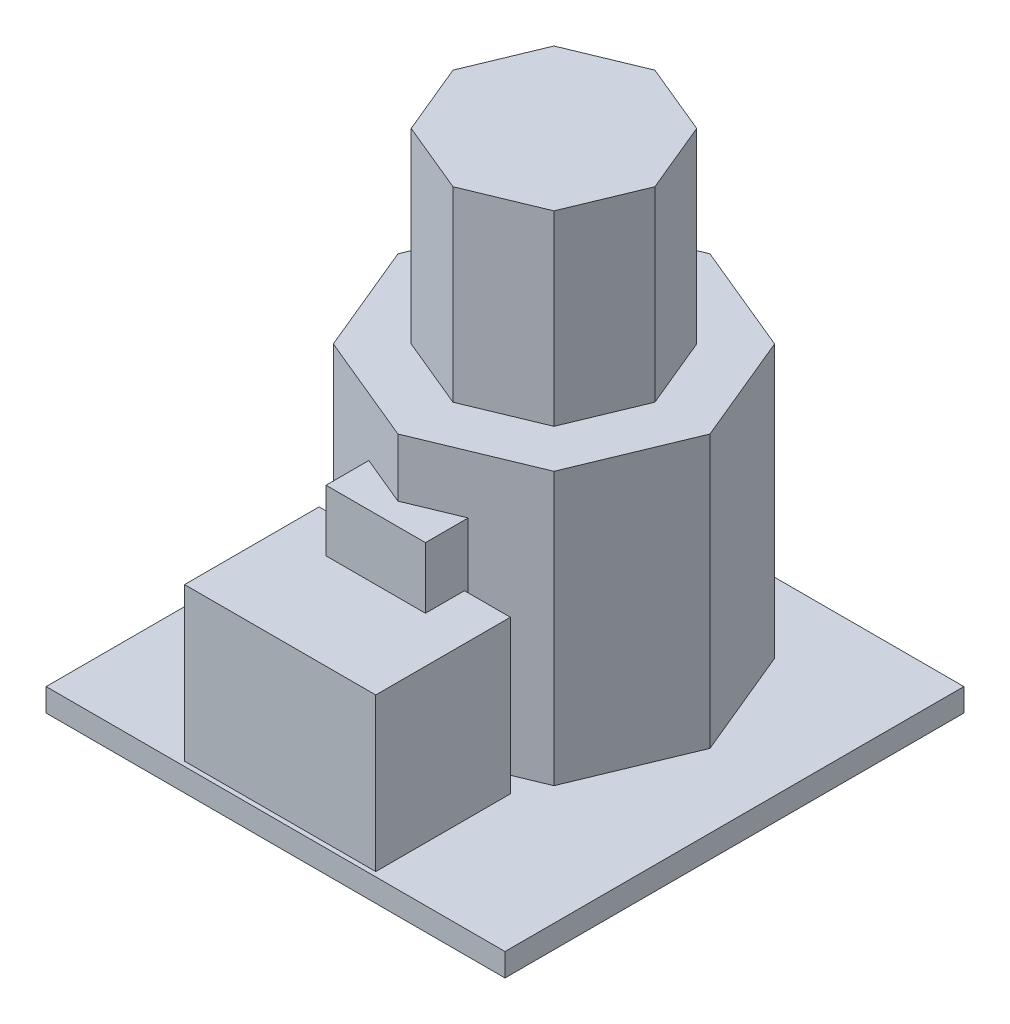
from build123d import *

# Parameters (mm, degrees)
SKETCH_1_W      = 300
SKETCH_1_H      = 300
EXTRUDE_1_DEPTH = 15
EXTRUDE_2_DEPTH = 178
EXTRUDE_3_DEPTH = 300
SKETCH_4_W      = 125
SKETCH_4_H      = 88
EXTRUDE_4_DEPTH = 100
SKETCH_5_W      = 65
SKETCH_5_H      = 45
EXTRUDE_5_DEPTH = 140


with BuildPart() as part:
    # 草图1 → 凸台-拉伸1 (new body)
    with BuildSketch(Plane(origin=(0, 0, 0), x_dir=(1, 0, 0), z_dir=(0, 1, 0))):
        Rectangle(SKETCH_1_W, SKETCH_1_H)
    extrude(amount=-EXTRUDE_1_DEPTH)

    # 草图2 → 凸台-拉伸2 (add)
    with BuildSketch(Plane(origin=(0, 0, 0), x_dir=(1, 0, 0), z_dir=(0, 1, 0))):
        Polygon((102, 32), (72.124891681, 104.124891681), (0, 134), (-72.124891681, 104.124891681), (-102, 32), (-72.124891681, -40.124891681), (0, -70), (72.124891681, -40.124891681), align=None)
    extrude(amount=EXTRUDE_2_DEPTH)

    # 草图3 → 凸台-拉伸3 (add)
    with BuildSketch(Plane(origin=(0, 0, 0), x_dir=(1, 0, 0), z_dir=(0, 1, 0))):
        Polygon((66, 32), (46.669047558, 78.669047558), (0, 98), (-46.669047558, 78.669047558), (-66, 32), (-46.669047558, -14.669047558), (0, -34), (46.669047558, -14.669047558), align=None)
    extrude(amount=EXTRUDE_3_DEPTH)

    # 草图4 → 凸台-拉伸4 (add)
    with BuildSketch(Plane(origin=(0, 0, 0), x_dir=(1, 0, 0), z_dir=(0, 1, 0))):
        with Locations((0, -103)):
            Rectangle(SKETCH_4_W, SKETCH_4_H)
    extrude(amount=EXTRUDE_4_DEPTH)

    # 草图5 → 凸台-拉伸5 (add)
    with BuildSketch(Plane(origin=(0, 0, 0), x_dir=(1, 0, 0), z_dir=(0, 1, 0))):
        with Locations((0, -62)):
            Rectangle(SKETCH_5_W, SKETCH_5_H)
    extrude(amount=EXTRUDE_5_DEPTH)


solid = part.part
